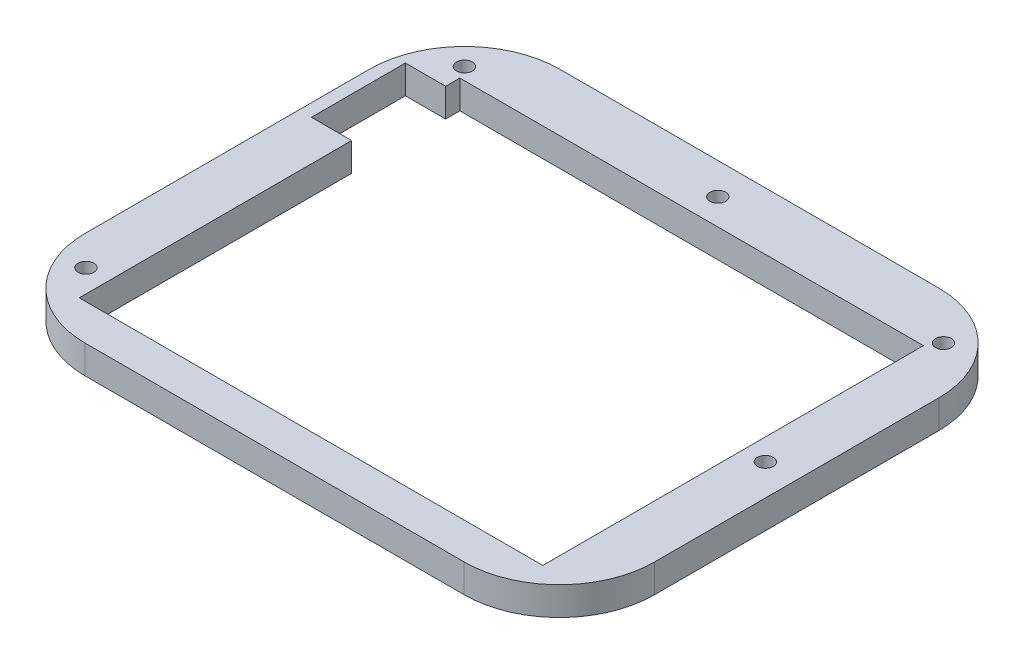
from build123d import *

# Parameters (mm, degrees)
BOSS_EXTRUDE1_DEPTH    = 6
SKETCH2_W              = 98
SKETCH2_H              = 80.5
CUT_EXTRUDE1_DEPTH     = 79.33262411
SKETCH5_R              = 1.75
CUT_EXTRUDE4_DEPTH     = 79.33262411
SKETCH6_W              = 8.5
SKETCH6_H              = 20
CUT_EXTRUDE5_DEPTH     = 79.33262411
MOVE_FACE1_OUTLINE_R   = 1.75
MOVE_FACE1_OUTLINE_R_2 = 1.67
MOVE_FACE1_DEPTH       = 6


# Read off the part's stored shape, not the designer's step: Move Face1
with BuildPart() as part:
    # Sketch1 → Boss-Extrude1 (new body)
    with BuildSketch(Plane(origin=(0, 0, 0), x_dir=(1, 0, 0), z_dir=(0, 1, 0))):
        with BuildLine():
            Line((-60, 30), (-60, -30))
            ThreePointArc((-60, -30), (-54.142135624, -44.142135624), (-40, -50))
            Line((-40, -50), (40, -50))
            ThreePointArc((40, -50), (54.142135624, -44.142135624), (60, -30))
            Line((60, -30), (60, 30))
            ThreePointArc((60, 30), (54.142135624, 44.142135624), (40, 50))
            Line((40, 50), (-40, 50))
            ThreePointArc((-40, 50), (-54.142135624, 44.142135624), (-60, 30))
        make_face()
    extrude(amount=BOSS_EXTRUDE1_DEPTH)

    # Sketch2 → Cut-Extrude1 (cut, through all)
    with BuildSketch(Plane(origin=(0, 6, 0), x_dir=(1, 0, 0), z_dir=(0, 1, 0))):
        with Locations((0, -2.25)):
            Rectangle(SKETCH2_W, SKETCH2_H)
    extrude(amount=-CUT_EXTRUDE1_DEPTH, mode=Mode.SUBTRACT)

    # Sketch5 → Cut-Extrude4 (cut, through all)
    with BuildSketch(Plane(origin=(0, 6, 0), x_dir=(1, 0, 0), z_dir=(0, 1, 0))):
        with Locations(Location((53.475, 0, 0), (0, 0, 270))):
            Circle(SKETCH5_R)
        with Locations(Location((-53.709292606, -36.227375296, 0), (0, 0, 270))):
            Circle(SKETCH5_R)
        with Locations(Location((0, 43.45, 0), (0, 0, 270))):
            Circle(SKETCH5_R)
        with Locations(Location((50.558556763, 40.508556763, 0), (0, 0, 270))):
            Circle(SKETCH5_R)
        with Locations(Location((-50.558556763, 40.508556763, 0), (0, 0, 90))):
            Circle(SKETCH5_R)
    extrude(amount=-CUT_EXTRUDE4_DEPTH, mode=Mode.SUBTRACT)

    # Sketch6 → Cut-Extrude5 (cut, through all)
    with BuildSketch(Plane(origin=(0, 6, 0), x_dir=(1, 0, 0), z_dir=(0, 1, 0))):
        with Locations((-53.25, 25)):
            Rectangle(SKETCH6_W, SKETCH6_H)
    extrude(amount=-CUT_EXTRUDE5_DEPTH, mode=Mode.SUBTRACT)

    # Move Face1 outline → Move Face1 (add)
    # profile 1 of 7: a face of its own
    with BuildSketch(Plane(origin=(0, 0, 0), x_dir=(1, 0, 0), z_dir=(0, 1, 0))):
        with BuildLine():
            ThreePointArc((-40, 50.08), (-54.198704166, 44.198704166), (-60.08, 30))
            Line((-60.08, 30), (-60.08, -30))
            ThreePointArc((-60.08, -30), (-54.198704166, -44.198704166), (-40, -50.08))
            Line((-40, -50.08), (40, -50.08))
            ThreePointArc((40, -50.08), (54.198704166, -44.198704166), (60.08, -30))
            Line((60.08, -30), (60.08, 30))
            ThreePointArc((60.08, 30), (54.198704166, 44.198704166), (40, 50.08))
            Line((40, 50.08), (-40, 50.08))
        make_face()
        with BuildLine():
            Line((-60, -30), (-60, 30))
            ThreePointArc((-60, 30), (-54.142135624, 44.142135624), (-40, 50))
            Line((-40, 50), (40, 50))
            ThreePointArc((40, 50), (54.142135624, 44.142135624), (60, 30))
            Line((60, 30), (60, -30))
            ThreePointArc((60, -30), (54.142135624, -44.142135624), (40, -50))
            Line((40, -50), (-40, -50))
            ThreePointArc((-40, -50), (-54.142135624, -44.142135624), (-60, -30))
        make_face(mode=Mode.SUBTRACT)
    # profile 2 of 7: a face of its own
    with BuildSketch(Plane(origin=(0, 0, 0), x_dir=(1, 0, 0), z_dir=(0, 1, 0))):
        Polygon((-57.5, 15), (-49, 15), (-49, -42.5), (49, -42.5), (49, 38), (-49, 38), (-49, 35), (-57.5, 35), align=None)
        Polygon((-48.92, -42.42), (-48.92, 15.08), (-57.42, 15.08), (-57.42, 34.92), (-48.92, 34.92), (-48.92, 37.92), (48.92, 37.92), (48.92, -42.42), align=None, mode=Mode.SUBTRACT)
    # profile 3 of 7: a face of its own
    with BuildSketch(Plane(origin=(0, 0, 0), x_dir=(1, 0, 0), z_dir=(0, 1, 0))):
        with Locations((53.475, 0)):
            Circle(MOVE_FACE1_OUTLINE_R)
        with Locations((53.475, 0)):
            Circle(MOVE_FACE1_OUTLINE_R_2, mode=Mode.SUBTRACT)
    # profile 4 of 7: a face of its own
    with BuildSketch(Plane(origin=(0, 0, 0), x_dir=(1, 0, 0), z_dir=(0, 1, 0))):
        with Locations((0, 43.45)):
            Circle(MOVE_FACE1_OUTLINE_R)
        with Locations((0, 43.45)):
            Circle(MOVE_FACE1_OUTLINE_R_2, mode=Mode.SUBTRACT)
    # profile 5 of 7: a face of its own
    with BuildSketch(Plane(origin=(0, 0, 0), x_dir=(1, 0, 0), z_dir=(0, 1, 0))):
        with Locations((50.558556763, 40.508556763)):
            Circle(MOVE_FACE1_OUTLINE_R)
        with Locations((50.558556763, 40.508556763)):
            Circle(MOVE_FACE1_OUTLINE_R_2, mode=Mode.SUBTRACT)
    # profile 6 of 7: a face of its own
    with BuildSketch(Plane(origin=(0, 0, 0), x_dir=(1, 0, 0), z_dir=(0, 1, 0))):
        with Locations((-50.558556763, 40.508556763)):
            Circle(MOVE_FACE1_OUTLINE_R)
        with Locations((-50.558556763, 40.508556763)):
            Circle(MOVE_FACE1_OUTLINE_R_2, mode=Mode.SUBTRACT)
    # profile 7 of 7: a face of its own
    with BuildSketch(Plane(origin=(0, 0, 0), x_dir=(1, 0, 0), z_dir=(0, 1, 0))):
        with Locations((-53.709292606, -36.227375296)):
            Circle(MOVE_FACE1_OUTLINE_R)
        with Locations((-53.709292606, -36.227375296)):
            Circle(MOVE_FACE1_OUTLINE_R_2, mode=Mode.SUBTRACT)
    extrude(amount=MOVE_FACE1_DEPTH)


solid = part.part
